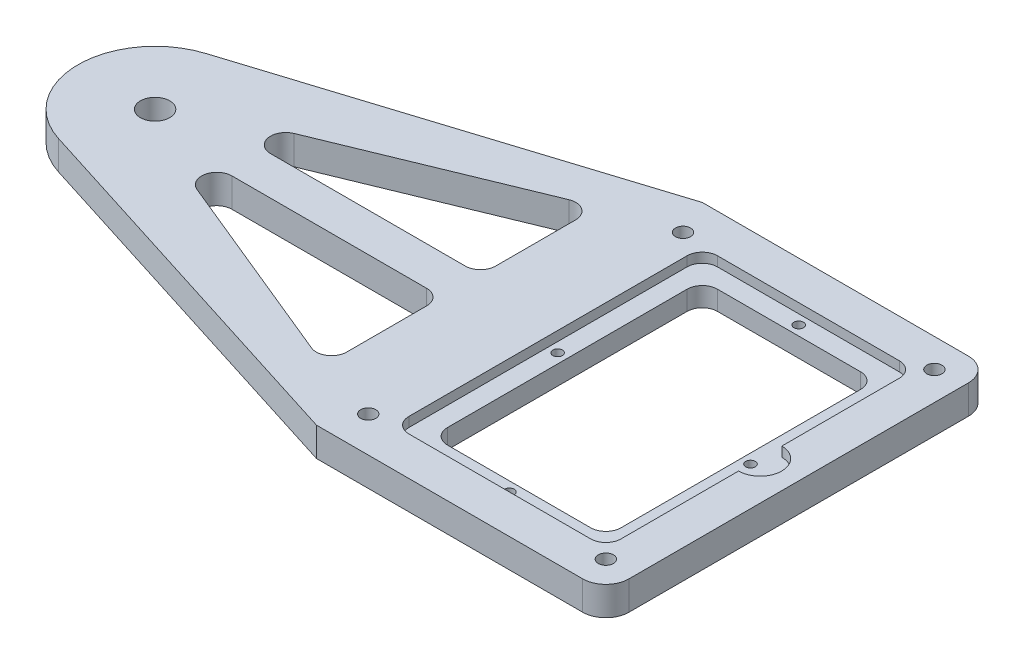
from build123d import *

# Parameters (mm, degrees)
SKETCH1_W           = 95.25
SKETCH1_H           = 127
BOSS_EXTRUDE1_DEPTH = 9.525
BOSS_EXTRUDE3_DEPTH = 9.525
SKETCH5_R           = 4.826
CUT_EXTRUDE1_DEPTH  = 201.236295422
CUT_EXTRUDE2_DEPTH  = 201.236295422
FILLET9_R           = 5
SKETCH7_R           = 5.453804141
BOSS_EXTRUDE4_DEPTH = 6.35
SKETCH8_W           = 69.85
SKETCH8_H           = 101.6
CUT_EXTRUDE3_DEPTH  = 3.175
SKETCH9_W           = 57.15
SKETCH9_H           = 88.9
CUT_EXTRUDE4_DEPTH  = 201.11039673
SKETCH11_R          = 1.5875
CUT_EXTRUDE6_DEPTH  = 201.11039673
CUT_EXTRUDE7_DEPTH  = 3.175
FILLET10_R          = 5
FILLET11_R          = 5
FILLET12_R          = 7.62
SKETCH13_R          = 2.4892
CUT_EXTRUDE8_DEPTH  = 201.236295422


with BuildPart() as part:
    # Sketch1 → Boss-Extrude1 (new body)
    with BuildSketch(Plane(origin=(0, 0, 0), x_dir=(1, 0, 0), z_dir=(0, 1, 0))):
        Rectangle(SKETCH1_W, SKETCH1_H)
    extrude(amount=BOSS_EXTRUDE1_DEPTH)

    # Sketch4 → Boss-Extrude3 (add)
    with BuildSketch(Plane(origin=(0, 9.525, 0), x_dir=(1, 0, 0), z_dir=(0, 1, 0))):
        with BuildLine():
            Line((-47.625, 63.5), (-171.916018217, 24.219268021))
            ThreePointArc((-171.916018217, 24.219268021), (-189.6618, 0), (-171.916018217, -24.219268021))
            Line((-171.916018217, -24.219268021), (-47.625, -63.5))
            Line((-47.625, -63.5), (-47.625, 63.5))
        make_face()
    extrude(amount=-BOSS_EXTRUDE3_DEPTH)

    # Sketch5 → Cut-Extrude1 (cut, through all)
    with BuildSketch(Plane(origin=(0, 9.525, 0), x_dir=(1, 0, 0), z_dir=(0, 1, 0))):
        with Locations((-164.2618, 0)):
            Circle(SKETCH5_R)
        with Locations((-8.6868, 0)):
            Circle(SKETCH5_R)
    extrude(amount=-CUT_EXTRUDE1_DEPTH, mode=Mode.SUBTRACT)

    # Sketch6 → Cut-Extrude2 (cut, through all)
    with BuildSketch(Plane(origin=(0, 9.525, 0), x_dir=(1, 0, 0), z_dir=(0, 1, 0))):
        Polygon((-63.5, 45.163743355), (-157.9118, 6.35), (-63.5, 6.35), align=None)
        Polygon((-63.5, -6.35), (-63.5, -45.163743355), (-157.9118, -6.35), align=None)
    extrude(amount=-CUT_EXTRUDE2_DEPTH, mode=Mode.SUBTRACT)

    # Fillet9
    fillet9_edges = [part.edges().sort_by_distance(p)[0] for p in [
        (-157.9118, 4.7625, 6.35),
        (-63.5, 4.7625, 6.35),
        (-63.5, 4.7625, 45.163743355),
        (-63.5, 4.7625, -6.35),
        (-157.9118, 4.7625, -6.35),
        (-63.5, 4.7625, -45.163743355),
    ]]
    fillet(fillet9_edges, radius=FILLET9_R)

    # Sketch7 → Boss-Extrude4 (add)
    with BuildSketch(Plane(origin=(0, 9.525, 0), x_dir=(1, 0, 0), z_dir=(0, 1, 0))):
        with Locations((-8.6868, 0)):
            Circle(SKETCH7_R)
    extrude(amount=-BOSS_EXTRUDE4_DEPTH)

    # Sketch8 → Cut-Extrude3 (cut)
    with BuildSketch(Plane(origin=(0, 9.525, 0), x_dir=(1, 0, 0), z_dir=(0, 1, 0))):
        Rectangle(SKETCH8_W, SKETCH8_H)
    extrude(amount=-CUT_EXTRUDE3_DEPTH, mode=Mode.SUBTRACT)

    # Sketch9 → Cut-Extrude4 (cut, through all)
    with BuildSketch(Plane(origin=(0, 6.35, 0), x_dir=(1, 0, 0), z_dir=(0, 1, 0))):
        Rectangle(SKETCH9_W, SKETCH9_H)
    extrude(amount=-CUT_EXTRUDE4_DEPTH, mode=Mode.SUBTRACT)

    # Sketch11 → Cut-Extrude6 (cut, through all)
    with BuildSketch(Plane(origin=(0, 6.35, 0), x_dir=(1, 0, 0), z_dir=(0, 1, 0))):
        with Locations((-31.75, 0)):
            Circle(SKETCH11_R)
        with Locations((31.75, 0)):
            Circle(SKETCH11_R)
        with Locations((0, 47.625)):
            Circle(SKETCH11_R)
        with Locations((0, -47.625)):
            Circle(SKETCH11_R)
    extrude(amount=-CUT_EXTRUDE6_DEPTH, mode=Mode.SUBTRACT)

    # Sketch12 → Cut-Extrude7 (cut)
    with BuildSketch(Plane(origin=(0, 9.525, 0), x_dir=(1, 0, 0), z_dir=(0, 1, 0))):
        with BuildLine():
            Line((34.925, 7.112), (34.925, -7.112))
            ThreePointArc((34.925, -7.112), (42.037, 0), (34.925, 7.112))
        make_face()
    extrude(amount=-CUT_EXTRUDE7_DEPTH, mode=Mode.SUBTRACT)

    # Fillet10
    fillet10_edges = [part.edges().sort_by_distance(p)[0] for p in [
        (-34.925, 7.9375, 50.8),
        (34.925, 7.9375, 50.8),
        (34.925, 7.9375, -50.8),
        (-34.925, 7.9375, -50.8),
    ]]
    fillet(fillet10_edges, radius=FILLET10_R)

    # Fillet11
    fillet11_edges = [part.edges().sort_by_distance(p)[0] for p in [
        (-28.575, 3.175, -44.45),
        (28.575, 3.175, -44.45),
        (28.575, 3.175, 44.45),
        (-28.575, 3.175, 44.45),
    ]]
    fillet(fillet11_edges, radius=FILLET11_R)

    # Fillet12
    fillet12_edges = [part.edges().sort_by_distance(p)[0] for p in [
        (47.625, 4.7625, -63.5),
        (47.625, 4.7625, 63.5),
    ]]
    fillet(fillet12_edges, radius=FILLET12_R)

    # Sketch13 → Cut-Extrude8 (cut, through all)
    with BuildSketch(Plane(origin=(0, 9.525, 0), x_dir=(1, 0, 0), z_dir=(0, 1, 0))):
        with Locations((-42.286053483, 51.811053483)):
            Circle(SKETCH13_R)
        with Locations((-42.286053483, -51.811053483)):
            Circle(SKETCH13_R)
        with Locations((38.202339924, -54.077339924)):
            Circle(SKETCH13_R)
        with Locations((38.202339924, 54.077339924)):
            Circle(SKETCH13_R)
    extrude(amount=-CUT_EXTRUDE8_DEPTH, mode=Mode.SUBTRACT)


solid = part.part
